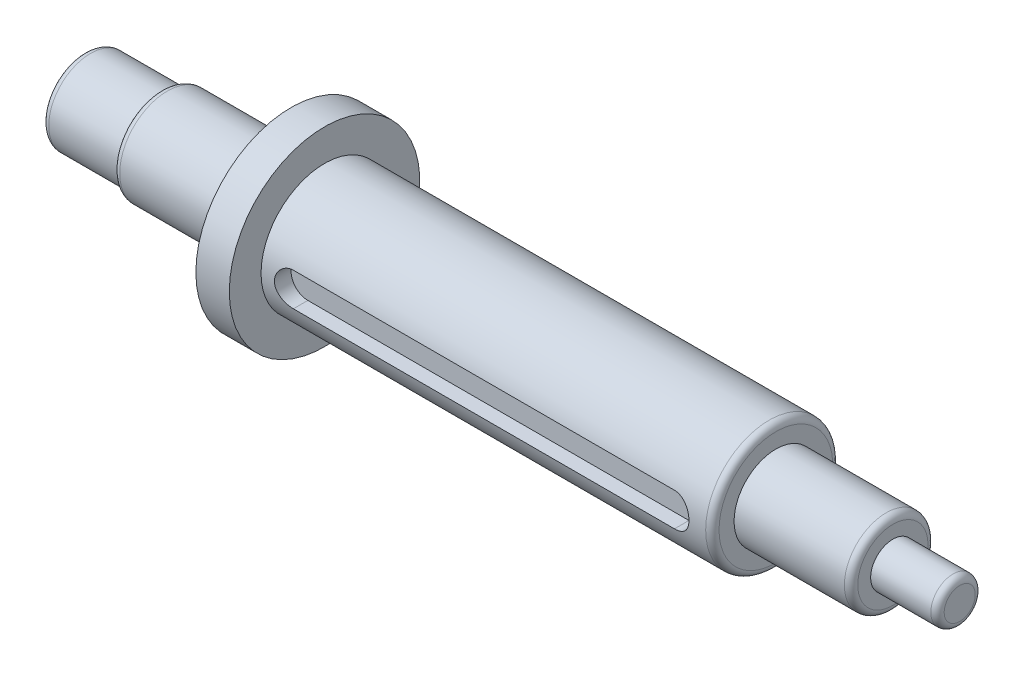
from build123d import *

# Parameters (mm, degrees)
FILLET_1_R          = 2
CUT_EXTRUDE_1_DEPTH = 5


with BuildPart() as part:
    # Эскиз1 → Повернуть1 (revolve)
    with BuildSketch(Plane(origin=(0, 0, 0), x_dir=(1, 0, 0), z_dir=(0, 1, 0)), mode=Mode.PRIVATE) as revolve_1_sk:
        Polygon((0, 0), (0, 12.5), (23, 12.5), (23, 14.25), (62, 14.25), (62, 28.5), (72, 28.5), (72, 19), (207, 19), (207, 12.5), (242, 12.5), (242, 6.65), (262, 6.65), (262, 0), align=None)
    revolve(revolve_1_sk.sketch.rotate(Axis((0, 0, 0), (1, 0, 0)), 180), axis=Axis((0, 0, 0), (1, 0, 0)))

    # Скругление1
    # the kernel refuses this fillet: 2 mm, written as the material it takes off along each edge
    with BuildSketch(Plane(origin=(262, 0, 0), x_dir=(0, 0, 1), z_dir=(0, 1, 0))) as fillet_1_piece_1:
        with BuildLine():
            CenterArc((6.65 - FILLET_1_R, -FILLET_1_R), FILLET_1_R, 0, 90)
            Line((6.65 - FILLET_1_R, 0), (6.65 - FILLET_1_R, FILLET_1_R * 0.02))
            Line((6.65 - FILLET_1_R, FILLET_1_R * 0.02), (6.65 + FILLET_1_R * 0.02, FILLET_1_R * 0.02))
            Line((6.65 + FILLET_1_R * 0.02, FILLET_1_R * 0.02), (6.65 + FILLET_1_R * 0.02, -FILLET_1_R))
            Line((6.65 + FILLET_1_R * 0.02, -FILLET_1_R), (6.65, -FILLET_1_R))
        make_face()
    revolve(axis=Axis((262, 0, 0), (1, 0, 0)), mode=Mode.SUBTRACT)
    with BuildSketch(Plane(origin=(242, 0, 0), x_dir=(0, 0, 1), z_dir=(0, 1, 0))) as fillet_1_piece_2:
        with BuildLine():
            CenterArc((12.5 - FILLET_1_R, -FILLET_1_R), FILLET_1_R, 0, 90)
            Line((12.5 - FILLET_1_R, 0), (12.5 - FILLET_1_R, FILLET_1_R * 0.02))
            Line((12.5 - FILLET_1_R, FILLET_1_R * 0.02), (12.5 + FILLET_1_R * 0.02, FILLET_1_R * 0.02))
            Line((12.5 + FILLET_1_R * 0.02, FILLET_1_R * 0.02), (12.5 + FILLET_1_R * 0.02, -FILLET_1_R))
            Line((12.5 + FILLET_1_R * 0.02, -FILLET_1_R), (12.5, -FILLET_1_R))
        make_face()
    revolve(axis=Axis((242, 0, 0), (1, 0, 0)), mode=Mode.SUBTRACT)
    with BuildSketch(Plane(origin=(207, 0, 0), x_dir=(0, 0, 1), z_dir=(0, 1, 0))) as fillet_1_piece_3:
        with BuildLine():
            CenterArc((19 - FILLET_1_R, -FILLET_1_R), FILLET_1_R, 0, 90)
            Line((19 - FILLET_1_R, 0), (19 - FILLET_1_R, FILLET_1_R * 0.02))
            Line((19 - FILLET_1_R, FILLET_1_R * 0.02), (19 + FILLET_1_R * 0.02, FILLET_1_R * 0.02))
            Line((19 + FILLET_1_R * 0.02, FILLET_1_R * 0.02), (19 + FILLET_1_R * 0.02, -FILLET_1_R))
            Line((19 + FILLET_1_R * 0.02, -FILLET_1_R), (19, -FILLET_1_R))
        make_face()
    revolve(axis=Axis((207, 0, 0), (1, 0, 0)), mode=Mode.SUBTRACT)
    with BuildSketch(Plane(origin=(23, 0, 0), x_dir=(0, 0, 1), z_dir=(0, 1, 0))) as fillet_1_piece_4:
        with BuildLine():
            CenterArc((12.25, 1.984313483), FILLET_1_R, 277.180755781, 82.819244219)
            Line((14.25, 1.984313483), (14.29, 1.984313483))
            Line((14.29, 1.984313483), (14.29, 0))
            Line((14.29, 0), (14.25, -0.04))
            ThreePointArc((14.25, -0.04), (13.375, -0.04), (12.505, -0.03968627))
            Line((12.505, -0.03968627), (12.5, 0))
        make_face()
    revolve(axis=Axis((23, 0, 0), (1, 0, 0)), mode=Mode.SUBTRACT)
    with BuildSketch(Plane(origin=(0, 0, 0), x_dir=(0, 0, 1), z_dir=(0, 1, 0))) as fillet_1_piece_5:
        with BuildLine():
            CenterArc((12.5 - FILLET_1_R, FILLET_1_R), FILLET_1_R, 270, 90)
            Line((12.5, FILLET_1_R), (12.5 + FILLET_1_R * 0.02, FILLET_1_R))
            Line((12.5 + FILLET_1_R * 0.02, FILLET_1_R), (12.5 + FILLET_1_R * 0.02, -FILLET_1_R * 0.02))
            Line((12.5 + FILLET_1_R * 0.02, -FILLET_1_R * 0.02), (12.5 - FILLET_1_R, -FILLET_1_R * 0.02))
            Line((12.5 - FILLET_1_R, -FILLET_1_R * 0.02), (12.5 - FILLET_1_R, 0))
        make_face()
    revolve(axis=Axis((0, 0, 0), (1, 0, 0)), mode=Mode.SUBTRACT)

    # Эскиз2 → Вырез-Вытянуть1 (cut)
    with BuildSketch(Plane.XY.offset(19)):
        with BuildLine():
            Line((81, 5), (195, 5))
            ThreePointArc((195, 5), (200, 0), (195, -5))
            Line((195, -5), (81, -5))
            ThreePointArc((81, -5), (76, 0), (81, 5))
        make_face()
    extrude(amount=-CUT_EXTRUDE_1_DEPTH, mode=Mode.SUBTRACT)


solid = part.part
